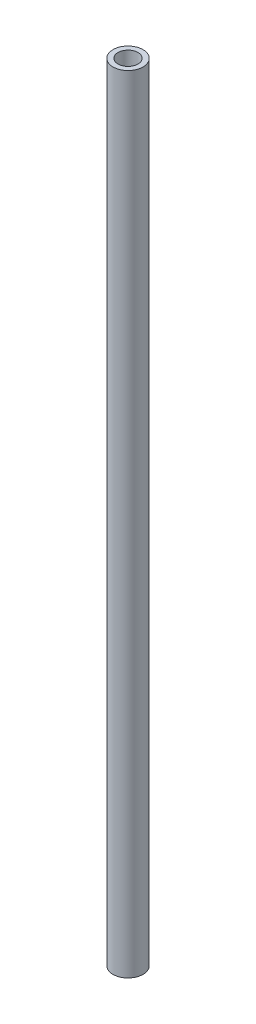
from build123d import *

# Parameters (mm, degrees)
SKETCH1_W          = 3
SKETCH1_H          = 157
SKETCH3_R          = 2
CUT_EXTRUDE1_DEPTH = 158.097591383


with BuildPart() as part:
    # Sketch1 → Revolve1 (revolve)
    with BuildSketch(Plane.XY.offset(1.653301878)):
        with Locations((1.5, -78.5)):
            Rectangle(SKETCH1_W, SKETCH1_H)
    revolve(axis=Axis((0, 0, 1.653301878), (0, -1, 0)))

    # Sketch3 → Cut-Extrude1 (cut, through all)
    with BuildSketch(Plane(origin=(0, 0, 0), x_dir=(1, 0, 0), z_dir=(0, 1, 0))):
        with Locations(Location((0, -1.653301878, 0), (0, 0, 180))):
            Circle(SKETCH3_R)
    extrude(amount=-CUT_EXTRUDE1_DEPTH, mode=Mode.SUBTRACT)


with BuildPart() as part_1:
    # Body-Move/Copy1: read off the stored shape, not the designer's step
    # Body-Move/Copy1: moved
    add(part.part.moved(Location((0, 157, -1.6533019))))


solid = part_1.part
